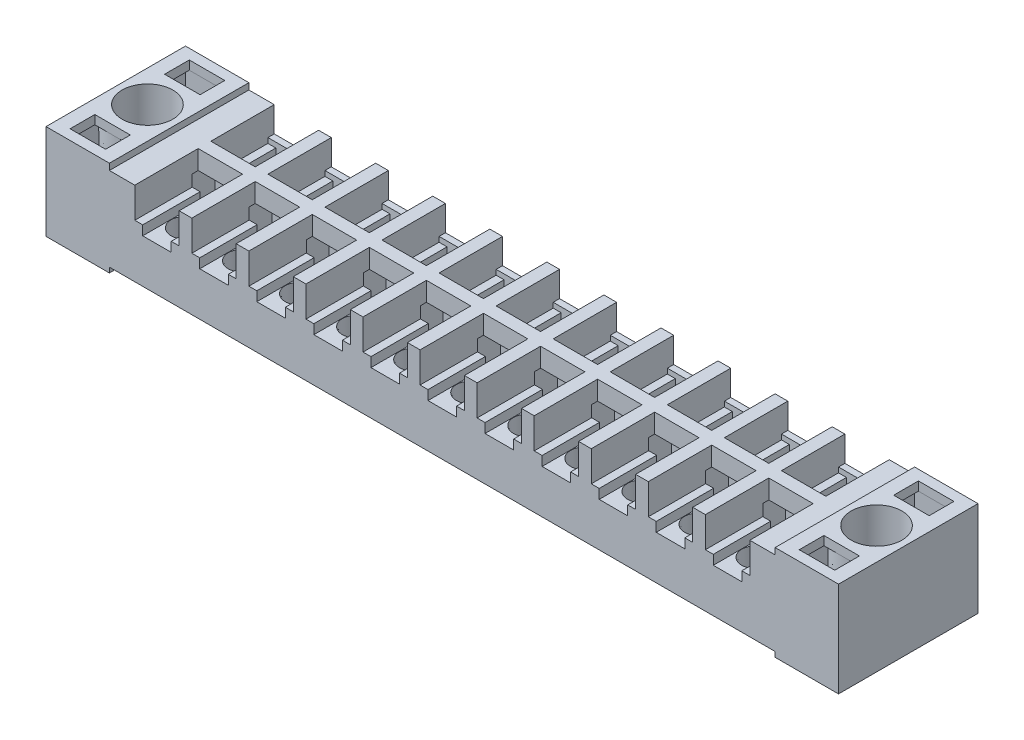
from build123d import *

# Parameters (mm, degrees)
SKETCH1_W                        = 125
SKETCH1_H                        = 22
MAIN_BODY_DEPTH                  = 15
CBORE_FOR_M4_SHCS1_D             = 4.8
CBORE_FOR_M4_SHCS1_CBORE_D       = 8
CBORE_FOR_M4_SHCS1_CBORE_DEPTH   = 11
SKETCH4_W                        = 5.6
SKETCH4_H                        = 3.9
TOP_RECTANGULAR_CUT_DEPTH        = 1.4
BOTTOM_RECTANGULAR_CUT_DEPTH     = 13.6
BOTTOM_RECTANGULAR_CUT_DRAFT     = -1
MIRROR6_COPY_1_DEPTH             = 13.6
MIRROR6_COPY_1_DRAFT             = -1
MIRROR8_COPY_1_DEPTH             = 13.6
MIRROR8_COPY_1_DRAFT             = -1
MIRROR8_COPY_2_SKETCH_W          = 5.6
MIRROR8_COPY_2_SKETCH_H          = 3.9
MIRROR8_COPY_2_DEPTH             = 1.4
MIRROR8_COPY_3_DEPTH             = 13.6
MIRROR8_COPY_3_DRAFT             = -1
SKETCH11_W                       = 105
SKETCH11_H                       = 22
BOTTOM_BASE_CUT_DEPTH            = 0.8
SKETCH6_W                        = 105
SKETCH6_H                        = 7
BOTTOM_BOSSED_FEATURE_BASE_DEPTH = 5.6
BOTTOM_BOSSED_FEATURE_BASE_DRAFT = -1
MIRROR9_COPY_1_SKETCH_W          = 105
MIRROR9_COPY_1_SKETCH_H          = 7
MIRROR9_COPY_1_DEPTH             = 5.6
MIRROR9_COPY_1_DRAFT             = -1
SKETCH7_R                        = 2.75
BOSSED_CYLINDER_DEPTH            = 5.6
BOSSED_CYLINDER_TAPER            = 1
FILL_PATTERN1_OUTLINE_R          = 2.652251636
FILL_PATTERN1_DEPTH              = 5.6
FILL_PATTERN1_DRAFT              = -1
FILL_PATTERN1_2_OUTLINE_R        = 2.652251636
FILL_PATTERN1_2_DEPTH            = 5.6
FILL_PATTERN1_2_DRAFT            = -1
FILL_PATTERN1_3_OUTLINE_R        = 2.652251636
FILL_PATTERN1_3_DEPTH            = 5.6
FILL_PATTERN1_3_DRAFT            = -1
FILL_PATTERN1_4_OUTLINE_R        = 2.652251636
FILL_PATTERN1_4_DEPTH            = 5.6
FILL_PATTERN1_4_DRAFT            = -1
FILL_PATTERN1_5_OUTLINE_R        = 2.652251636
FILL_PATTERN1_5_DEPTH            = 5.6
FILL_PATTERN1_5_DRAFT            = -1
FILL_PATTERN1_6_OUTLINE_R        = 2.652251636
FILL_PATTERN1_6_DEPTH            = 5.6
FILL_PATTERN1_6_DRAFT            = -1
FILL_PATTERN1_7_OUTLINE_R        = 2.652251636
FILL_PATTERN1_7_DEPTH            = 5.6
FILL_PATTERN1_7_DRAFT            = -1
FILL_PATTERN1_8_OUTLINE_R        = 2.652251636
FILL_PATTERN1_8_DEPTH            = 5.6
FILL_PATTERN1_8_DRAFT            = -1
FILL_PATTERN1_9_OUTLINE_R        = 2.652251636
FILL_PATTERN1_9_DEPTH            = 5.6
FILL_PATTERN1_9_DRAFT            = -1
FILL_PATTERN1_10_OUTLINE_R       = 2.652251636
FILL_PATTERN1_10_DEPTH           = 5.6
FILL_PATTERN1_10_DRAFT           = -1
FILL_PATTERN3_DEPTH              = 5.6
FILL_PATTERN3_DRAFT              = -1
FILL_PATTERN3_2_DEPTH            = 5.6
FILL_PATTERN3_2_DRAFT            = -1
FILL_PATTERN3_3_DEPTH            = 5.6
FILL_PATTERN3_3_DRAFT            = -1
FILL_PATTERN3_4_DEPTH            = 5.6
FILL_PATTERN3_4_DRAFT            = -1
FILL_PATTERN3_5_DEPTH            = 5.6
FILL_PATTERN3_5_DRAFT            = -1
FILL_PATTERN3_6_DEPTH            = 5.6
FILL_PATTERN3_6_DRAFT            = -1
FILL_PATTERN3_7_DEPTH            = 5.6
FILL_PATTERN3_7_DRAFT            = -1
FILL_PATTERN3_8_DEPTH            = 5.6
FILL_PATTERN3_8_DRAFT            = -1
FILL_PATTERN3_9_DEPTH            = 5.6
FILL_PATTERN3_9_DRAFT            = -1
FILL_PATTERN3_10_DEPTH           = 5.6
FILL_PATTERN3_10_DRAFT           = -1
SKETCH12_W                       = 105
SKETCH12_H                       = 22
TOP_BASE_CUT_DEPTH               = 1
SKETCH8_W                        = 7
SKETCH8_H                        = 10
SMALL_DEPTH_TERMINAL_CUT_DEPTH   = 4
SKETCH9_W                        = 7
SKETCH9_H                        = 10
LARGE_DEPTH_TERMINAL_CUT_DEPTH   = 4.8
SKETCH10_W                       = 7.6
SKETCH10_H                       = 3.9
MID_RECTANGULAR_CUT_DEPTH        = 10.2
SKETCH13_W                       = 4.5
SKETCH13_H                       = 21
STRIP_CUT_DEPTH                  = 1.5
SKETCH14_W                       = 7
SKETCH14_H                       = 8.05
TERMINAL_CUT_REAR_DEPTH          = 0.8
LPATTERN2_COUNT                  = 6
LPATTERN2_PITCH                  = 9
LPATTERN2_COL_COUNT              = 6
LPATTERN2_COL_PITCH              = 9
LPATTERN3_COUNT                  = 6
LPATTERN3_PITCH                  = 9
LPATTERN3_COL_COUNT              = 6
LPATTERN3_COL_PITCH              = 9
SKETCH15_R                       = 2.2
BOSSED_CYLINDER_CUT_DEPTH        = 4
BOSSED_CYLINDER_CUT_DRAFT        = -1
MIRROR11_COPY_1_SKETCH_R         = 2.2
MIRROR11_COPY_1_DEPTH            = 4
MIRROR11_COPY_1_DRAFT            = -1
LPATTERN4_COPY_1_SKETCH_R        = 2.2
LPATTERN4_COPY_1_DEPTH           = 4
LPATTERN4_COPY_1_DRAFT           = -1
LPATTERN4_COPY_2_SKETCH_R        = 2.2
LPATTERN4_COPY_2_DEPTH           = 4
LPATTERN4_COPY_2_DRAFT           = -1
LPATTERN4_COPY_3_SKETCH_R        = 2.2
LPATTERN4_COPY_3_DEPTH           = 4
LPATTERN4_COPY_3_DRAFT           = -1
LPATTERN4_COPY_4_SKETCH_R        = 2.2
LPATTERN4_COPY_4_DEPTH           = 4
LPATTERN4_COPY_4_DRAFT           = -1
LPATTERN4_COPY_5_SKETCH_R        = 2.2
LPATTERN4_COPY_5_DEPTH           = 4
LPATTERN4_COPY_5_DRAFT           = -1
LPATTERN4_COPY_6_SKETCH_R        = 2.2
LPATTERN4_COPY_6_DEPTH           = 4
LPATTERN4_COPY_6_DRAFT           = -1
LPATTERN4_COPY_7_SKETCH_R        = 2.2
LPATTERN4_COPY_7_DEPTH           = 4
LPATTERN4_COPY_7_DRAFT           = -1
LPATTERN4_COPY_8_SKETCH_R        = 2.2
LPATTERN4_COPY_8_DEPTH           = 4
LPATTERN4_COPY_8_DRAFT           = -1
LPATTERN4_COPY_9_SKETCH_R        = 2.2
LPATTERN4_COPY_9_DEPTH           = 4
LPATTERN4_COPY_9_DRAFT           = -1
LPATTERN4_COPY_10_SKETCH_R       = 2.2
LPATTERN4_COPY_10_DEPTH          = 4
LPATTERN4_COPY_10_DRAFT          = -1
LPATTERN4_COL_COPY_1_SKETCH_R    = 2.2
LPATTERN4_COL_COPY_1_DEPTH       = 4
LPATTERN4_COL_COPY_1_DRAFT       = -1
LPATTERN4_COL_COPY_2_SKETCH_R    = 2.2
LPATTERN4_COL_COPY_2_DEPTH       = 4
LPATTERN4_COL_COPY_2_DRAFT       = -1
LPATTERN4_COL_COPY_3_SKETCH_R    = 2.2
LPATTERN4_COL_COPY_3_DEPTH       = 4
LPATTERN4_COL_COPY_3_DRAFT       = -1
LPATTERN4_COL_COPY_4_SKETCH_R    = 2.2
LPATTERN4_COL_COPY_4_DEPTH       = 4
LPATTERN4_COL_COPY_4_DRAFT       = -1
LPATTERN4_COL_COPY_5_SKETCH_R    = 2.2
LPATTERN4_COL_COPY_5_DEPTH       = 4
LPATTERN4_COL_COPY_5_DRAFT       = -1
LPATTERN4_COL_COPY_6_SKETCH_R    = 2.2
LPATTERN4_COL_COPY_6_DEPTH       = 4
LPATTERN4_COL_COPY_6_DRAFT       = -1
LPATTERN4_COL_COPY_7_SKETCH_R    = 2.2
LPATTERN4_COL_COPY_7_DEPTH       = 4
LPATTERN4_COL_COPY_7_DRAFT       = -1
LPATTERN4_COL_COPY_8_SKETCH_R    = 2.2
LPATTERN4_COL_COPY_8_DEPTH       = 4
LPATTERN4_COL_COPY_8_DRAFT       = -1
LPATTERN4_COL_COPY_9_SKETCH_R    = 2.2
LPATTERN4_COL_COPY_9_DEPTH       = 4
LPATTERN4_COL_COPY_9_DRAFT       = -1
LPATTERN4_COL_COPY_10_SKETCH_R   = 2.2
LPATTERN4_COL_COPY_10_DEPTH      = 4
LPATTERN4_COL_COPY_10_DRAFT      = -1


# Read off the part's stored shape, not the designer's step: Fill Pattern1, Fill Pattern3
with BuildPart() as part:
    # Sketch1 → MAIN BODY (new body)
    with BuildSketch(Plane(origin=(0, 0, 0), x_dir=(1, 0, 0), z_dir=(0, 1, 0))):
        Rectangle(SKETCH1_W, SKETCH1_H)
    extrude(amount=MAIN_BODY_DEPTH)

    # CBORE for M4 SHCS1 (through all)
    with Locations(Plane(origin=(0, 15, 0), x_dir=(1, 0, 0), z_dir=(0, 1, 0))):
        with Locations((-57.5, 0)):
            cbore_for_m4_shcs1 = CounterBoreHole(CBORE_FOR_M4_SHCS1_D / 2, CBORE_FOR_M4_SHCS1_CBORE_D / 2, CBORE_FOR_M4_SHCS1_CBORE_DEPTH)

    # Sketch4 → TOP RECTANGULAR CUT (cut)
    with BuildSketch(Plane(origin=(0, 15, 0), x_dir=(1, 0, 0), z_dir=(0, 1, 0))):
        with Locations((-57.5, 7.45)):
            Rectangle(SKETCH4_W, SKETCH4_H)
    top_rectangular_cut = extrude(amount=-TOP_RECTANGULAR_CUT_DEPTH, mode=Mode.SUBTRACT)


with BuildPart() as bottom_rectangular_cut_tool:
    # Sketch5 → BOTTOM RECTANGULAR CUT (with draft: the straight prism first)
    with BuildSketch(Plane.XZ):
        with BuildLine():
            Line((-53.8, -9.7), (-53.8, -3.724580513))
            ThreePointArc((-53.8, -3.724580513), (-57.5, -5.25), (-61.2, -3.724580513))
            Line((-61.2, -3.724580513), (-61.2, -9.7))
            Line((-61.2, -9.7), (-53.8, -9.7))
        make_face()
    extrude(amount=-BOTTOM_RECTANGULAR_CUT_DEPTH)
    # BOTTOM RECTANGULAR CUT: the draft: its side faces are tilted about the plane it starts from
    bottom_rectangular_cut_sides = [bottom_rectangular_cut_tool.faces().sort_by_distance(p)[0] for p in [
        (-57.5, 6.8, -5.25),
        (-61.2, 6.8, -6.712290257),
        (-57.5, 6.8, -9.7),
        (-53.8, 6.8, -6.712290257),
    ]]
    draft(bottom_rectangular_cut_sides, Plane.XZ, BOTTOM_RECTANGULAR_CUT_DRAFT)


with BuildPart() as part_1:
    add(part.part)

    # BOTTOM RECTANGULAR CUT: cut by bottom_rectangular_cut_tool
    add(bottom_rectangular_cut_tool.part, mode=Mode.SUBTRACT)

    # Mirror1: CBORE for M4 SHCS1 across plane
    add(cbore_for_m4_shcs1.mirror(Plane(origin=(0, 0, 0), x_dir=(0, 0, 1), z_dir=(1, 0, 0))), mode=Mode.SUBTRACT)

    # Mirror6: TOP RECTANGULAR CUT across plane
    add(top_rectangular_cut.mirror(Plane.XY), mode=Mode.SUBTRACT)


with BuildPart() as mirror6_copy_1_tool:
    # Mirror6 copy 1 sketch → Mirror6 copy 1 (with draft: the straight prism first)
    with BuildSketch(Plane.XZ):
        with BuildLine():
            Line((-53.8, 9.7), (-53.8, 3.724580513))
            ThreePointArc((-53.8, 3.724580513), (-57.5, 5.25), (-61.2, 3.724580513))
            Line((-61.2, 3.724580513), (-61.2, 9.7))
            Line((-61.2, 9.7), (-53.8, 9.7))
        make_face()
    extrude(amount=-MIRROR6_COPY_1_DEPTH)
    # Mirror6 copy 1: the draft: its side faces are tilted about the plane it starts from
    mirror6_copy_1_sides = [mirror6_copy_1_tool.faces().sort_by_distance(p)[0] for p in [
        (-57.5, 6.8, 5.25),
        (-61.2, 6.8, 6.712290257),
        (-57.5, 6.8, 9.7),
        (-53.8, 6.8, 6.712290257),
    ]]
    draft(mirror6_copy_1_sides, Plane.XZ, MIRROR6_COPY_1_DRAFT)


with BuildPart() as part_2:
    add(part_1.part)

    # Mirror6 copy 1: cut by mirror6_copy_1_tool
    add(mirror6_copy_1_tool.part, mode=Mode.SUBTRACT)

    # Mirror8: TOP RECTANGULAR CUT across plane
    add(top_rectangular_cut.mirror(Plane(origin=(0, 0, 0), x_dir=(0, 0, 1), z_dir=(1, 0, 0))), mode=Mode.SUBTRACT)


with BuildPart() as mirror8_copy_1_tool:
    # Mirror8 copy 1 sketch → Mirror8 copy 1 (with draft: the straight prism first)
    with BuildSketch(Plane(origin=(0, 0, 0), x_dir=(-1, 0, 0), z_dir=(0, -1, 0))):
        with BuildLine():
            Line((-53.8, 9.7), (-53.8, 3.724580513))
            ThreePointArc((-53.8, 3.724580513), (-57.5, 5.25), (-61.2, 3.724580513))
            Line((-61.2, 3.724580513), (-61.2, 9.7))
            Line((-61.2, 9.7), (-53.8, 9.7))
        make_face()
    extrude(amount=-MIRROR8_COPY_1_DEPTH)
    # Mirror8 copy 1: the draft: its side faces are tilted about the plane it starts from
    mirror8_copy_1_sides = [mirror8_copy_1_tool.faces().sort_by_distance(p)[0] for p in [
        (57.5, 6.8, -5.25),
        (61.2, 6.8, -6.712290257),
        (57.5, 6.8, -9.7),
        (53.8, 6.8, -6.712290257),
    ]]
    draft(mirror8_copy_1_sides, Plane(origin=(0, 0, 0), x_dir=(-1, 0, 0), z_dir=(0, -1, 0)), MIRROR8_COPY_1_DRAFT)


with BuildPart() as part_3:
    add(part_2.part)

    # Mirror8 copy 1: cut by mirror8_copy_1_tool
    add(mirror8_copy_1_tool.part, mode=Mode.SUBTRACT)

    # Mirror8 copy 2 sketch → Mirror8 copy 2 (cut)
    with BuildSketch(Plane(origin=(0, 15, 0), x_dir=(-1, 0, 0), z_dir=(0, 1, 0))):
        with Locations((-57.5, 7.45)):
            Rectangle(MIRROR8_COPY_2_SKETCH_W, MIRROR8_COPY_2_SKETCH_H)
    extrude(amount=-MIRROR8_COPY_2_DEPTH, mode=Mode.SUBTRACT)


with BuildPart() as mirror8_copy_3_tool:
    # Mirror8 copy 3 sketch → Mirror8 copy 3 (with draft: the straight prism first)
    with BuildSketch(Plane(origin=(0, 0, 0), x_dir=(-1, 0, 0), z_dir=(0, -1, 0))):
        with BuildLine():
            Line((-53.8, -9.7), (-53.8, -3.724580513))
            ThreePointArc((-53.8, -3.724580513), (-57.5, -5.25), (-61.2, -3.724580513))
            Line((-61.2, -3.724580513), (-61.2, -9.7))
            Line((-61.2, -9.7), (-53.8, -9.7))
        make_face()
    extrude(amount=-MIRROR8_COPY_3_DEPTH)
    # Mirror8 copy 3: the draft: its side faces are tilted about the plane it starts from
    mirror8_copy_3_sides = [mirror8_copy_3_tool.faces().sort_by_distance(p)[0] for p in [
        (57.5, 6.8, 5.25),
        (61.2, 6.8, 6.712290257),
        (57.5, 6.8, 9.7),
        (53.8, 6.8, 6.712290257),
    ]]
    draft(mirror8_copy_3_sides, Plane(origin=(0, 0, 0), x_dir=(-1, 0, 0), z_dir=(0, -1, 0)), MIRROR8_COPY_3_DRAFT)


with BuildPart() as part_4:
    add(part_3.part)

    # Mirror8 copy 3: cut by mirror8_copy_3_tool
    add(mirror8_copy_3_tool.part, mode=Mode.SUBTRACT)

    # Sketch11 → BOTTOM BASE CUT (cut)
    with BuildSketch(Plane(origin=(0, 0, 0), x_dir=(-1, 0, 0), z_dir=(0, -1, 0))):
        Rectangle(SKETCH11_W, SKETCH11_H)
    extrude(amount=-BOTTOM_BASE_CUT_DEPTH, mode=Mode.SUBTRACT)


with BuildPart() as bottom_bossed_feature_base_tool:
    # Sketch6 → BOTTOM BOSSED FEATURE BASE (with draft: the straight prism first)
    with BuildSketch(Plane(origin=(0, 0.8, 0), x_dir=(-1, 0, 0), z_dir=(0, -1, 0))):
        with Locations((0, 6.5)):
            Rectangle(SKETCH6_W, SKETCH6_H)
    extrude(amount=-BOTTOM_BOSSED_FEATURE_BASE_DEPTH)
    # BOTTOM BOSSED FEATURE BASE: the draft: its side faces are tilted about the plane it starts from
    bottom_bossed_feature_base_sides = [bottom_bossed_feature_base_tool.faces().sort_by_distance(p)[0] for p in [
        (0, 3.6, -10),
        (52.5, 3.6, -6.5),
        (0, 3.6, -3),
        (-52.5, 3.6, -6.5),
    ]]
    draft(bottom_bossed_feature_base_sides, Plane(origin=(0, 0.8, 0), x_dir=(-1, 0, 0), z_dir=(0, -1, 0)), BOTTOM_BOSSED_FEATURE_BASE_DRAFT)


with BuildPart() as part_5:
    add(part_4.part)

    # BOTTOM BOSSED FEATURE BASE: cut by bottom_bossed_feature_base_tool
    add(bottom_bossed_feature_base_tool.part, mode=Mode.SUBTRACT)


with BuildPart() as mirror9_copy_1_tool:
    # Mirror9 copy 1 sketch → Mirror9 copy 1 (with draft: the straight prism first)
    with BuildSketch(Plane(origin=(0, 0.8, 0), x_dir=(-1, 0, 0), z_dir=(0, -1, 0))):
        with Locations((0, -6.5)):
            Rectangle(MIRROR9_COPY_1_SKETCH_W, MIRROR9_COPY_1_SKETCH_H)
    extrude(amount=-MIRROR9_COPY_1_DEPTH)
    # Mirror9 copy 1: the draft: its side faces are tilted about the plane it starts from
    mirror9_copy_1_sides = [mirror9_copy_1_tool.faces().sort_by_distance(p)[0] for p in [
        (0, 3.6, 10),
        (52.5, 3.6, 6.5),
        (0, 3.6, 3),
        (-52.5, 3.6, 6.5),
    ]]
    draft(mirror9_copy_1_sides, Plane(origin=(0, 0.8, 0), x_dir=(-1, 0, 0), z_dir=(0, -1, 0)), MIRROR9_COPY_1_DRAFT)


with BuildPart() as part_6:
    add(part_5.part)

    # Mirror9 copy 1: cut by mirror9_copy_1_tool
    add(mirror9_copy_1_tool.part, mode=Mode.SUBTRACT)

    # Sketch7 → BOSSED CYLINDER (add)
    with BuildSketch(Plane(origin=(0, 6.4, 0), x_dir=(-1, 0, 0), z_dir=(0, -1, 0))):
        with Locations((0, 6.555856208)):
            Circle(SKETCH7_R)
    bossed_cylinder = extrude(amount=BOSSED_CYLINDER_DEPTH, taper=BOSSED_CYLINDER_TAPER)


with BuildPart() as fill_pattern1_tool:
    # Fill Pattern1 outline → Fill Pattern1 (with draft: the straight prism first)
    with BuildSketch(Plane(origin=(0, 0.8, 0), x_dir=(1, 0, 0), z_dir=(0, 1, 0))):
        with Locations((9, 6.555856208)):
            Circle(FILL_PATTERN1_OUTLINE_R)
    extrude(amount=FILL_PATTERN1_DEPTH)
    # Fill Pattern1: the draft: its side faces are tilted about the plane it starts from
    fill_pattern1_sides = [fill_pattern1_tool.faces().sort_by_distance(p)[0] for p in [
        (6.347748364, 3.6, -6.555856208),
    ]]
    draft(fill_pattern1_sides, Plane(origin=(0, 0.8, 0), x_dir=(1, 0, 0), z_dir=(0, 1, 0)), FILL_PATTERN1_DRAFT)


with BuildPart() as part_7:
    add(part_6.part)

    # Fill Pattern1: add fill_pattern1_tool
    add(fill_pattern1_tool.part)


with BuildPart() as fill_pattern1_2_tool:
    # Fill Pattern1 2 outline → Fill Pattern1 2 (with draft: the straight prism first)
    with BuildSketch(Plane(origin=(0, 0.8, 0), x_dir=(1, 0, 0), z_dir=(0, 1, 0))):
        with Locations((-9, 6.555856208)):
            Circle(FILL_PATTERN1_2_OUTLINE_R)
    extrude(amount=FILL_PATTERN1_2_DEPTH)
    # Fill Pattern1 2: the draft: its side faces are tilted about the plane it starts from
    fill_pattern1_2_sides = [fill_pattern1_2_tool.faces().sort_by_distance(p)[0] for p in [
        (-11.652251636, 3.6, -6.555856208),
    ]]
    draft(fill_pattern1_2_sides, Plane(origin=(0, 0.8, 0), x_dir=(1, 0, 0), z_dir=(0, 1, 0)), FILL_PATTERN1_2_DRAFT)


with BuildPart() as part_8:
    add(part_7.part)

    # Fill Pattern1 2: add fill_pattern1_2_tool
    add(fill_pattern1_2_tool.part)


with BuildPart() as fill_pattern1_3_tool:
    # Fill Pattern1 3 outline → Fill Pattern1 3 (with draft: the straight prism first)
    with BuildSketch(Plane(origin=(0, 0.8, 0), x_dir=(1, 0, 0), z_dir=(0, 1, 0))):
        with Locations((18, 6.555856208)):
            Circle(FILL_PATTERN1_3_OUTLINE_R)
    extrude(amount=FILL_PATTERN1_3_DEPTH)
    # Fill Pattern1 3: the draft: its side faces are tilted about the plane it starts from
    fill_pattern1_3_sides = [fill_pattern1_3_tool.faces().sort_by_distance(p)[0] for p in [
        (15.347748364, 3.6, -6.555856208),
    ]]
    draft(fill_pattern1_3_sides, Plane(origin=(0, 0.8, 0), x_dir=(1, 0, 0), z_dir=(0, 1, 0)), FILL_PATTERN1_3_DRAFT)


with BuildPart() as part_9:
    add(part_8.part)

    # Fill Pattern1 3: add fill_pattern1_3_tool
    add(fill_pattern1_3_tool.part)


with BuildPart() as fill_pattern1_4_tool:
    # Fill Pattern1 4 outline → Fill Pattern1 4 (with draft: the straight prism first)
    with BuildSketch(Plane(origin=(0, 0.8, 0), x_dir=(1, 0, 0), z_dir=(0, 1, 0))):
        with Locations((-18, 6.555856208)):
            Circle(FILL_PATTERN1_4_OUTLINE_R)
    extrude(amount=FILL_PATTERN1_4_DEPTH)
    # Fill Pattern1 4: the draft: its side faces are tilted about the plane it starts from
    fill_pattern1_4_sides = [fill_pattern1_4_tool.faces().sort_by_distance(p)[0] for p in [
        (-20.652251636, 3.6, -6.555856208),
    ]]
    draft(fill_pattern1_4_sides, Plane(origin=(0, 0.8, 0), x_dir=(1, 0, 0), z_dir=(0, 1, 0)), FILL_PATTERN1_4_DRAFT)


with BuildPart() as part_10:
    add(part_9.part)

    # Fill Pattern1 4: add fill_pattern1_4_tool
    add(fill_pattern1_4_tool.part)


with BuildPart() as fill_pattern1_5_tool:
    # Fill Pattern1 5 outline → Fill Pattern1 5 (with draft: the straight prism first)
    with BuildSketch(Plane(origin=(0, 0.8, 0), x_dir=(1, 0, 0), z_dir=(0, 1, 0))):
        with Locations((27, 6.555856208)):
            Circle(FILL_PATTERN1_5_OUTLINE_R)
    extrude(amount=FILL_PATTERN1_5_DEPTH)
    # Fill Pattern1 5: the draft: its side faces are tilted about the plane it starts from
    fill_pattern1_5_sides = [fill_pattern1_5_tool.faces().sort_by_distance(p)[0] for p in [
        (24.347748364, 3.6, -6.555856208),
    ]]
    draft(fill_pattern1_5_sides, Plane(origin=(0, 0.8, 0), x_dir=(1, 0, 0), z_dir=(0, 1, 0)), FILL_PATTERN1_5_DRAFT)


with BuildPart() as part_11:
    add(part_10.part)

    # Fill Pattern1 5: add fill_pattern1_5_tool
    add(fill_pattern1_5_tool.part)


with BuildPart() as fill_pattern1_6_tool:
    # Fill Pattern1 6 outline → Fill Pattern1 6 (with draft: the straight prism first)
    with BuildSketch(Plane(origin=(0, 0.8, 0), x_dir=(1, 0, 0), z_dir=(0, 1, 0))):
        with Locations((-27, 6.555856208)):
            Circle(FILL_PATTERN1_6_OUTLINE_R)
    extrude(amount=FILL_PATTERN1_6_DEPTH)
    # Fill Pattern1 6: the draft: its side faces are tilted about the plane it starts from
    fill_pattern1_6_sides = [fill_pattern1_6_tool.faces().sort_by_distance(p)[0] for p in [
        (-29.652251636, 3.6, -6.555856208),
    ]]
    draft(fill_pattern1_6_sides, Plane(origin=(0, 0.8, 0), x_dir=(1, 0, 0), z_dir=(0, 1, 0)), FILL_PATTERN1_6_DRAFT)


with BuildPart() as part_12:
    add(part_11.part)

    # Fill Pattern1 6: add fill_pattern1_6_tool
    add(fill_pattern1_6_tool.part)


with BuildPart() as fill_pattern1_7_tool:
    # Fill Pattern1 7 outline → Fill Pattern1 7 (with draft: the straight prism first)
    with BuildSketch(Plane(origin=(0, 0.8, 0), x_dir=(1, 0, 0), z_dir=(0, 1, 0))):
        with Locations((36, 6.555856208)):
            Circle(FILL_PATTERN1_7_OUTLINE_R)
    extrude(amount=FILL_PATTERN1_7_DEPTH)
    # Fill Pattern1 7: the draft: its side faces are tilted about the plane it starts from
    fill_pattern1_7_sides = [fill_pattern1_7_tool.faces().sort_by_distance(p)[0] for p in [
        (33.347748364, 3.6, -6.555856208),
    ]]
    draft(fill_pattern1_7_sides, Plane(origin=(0, 0.8, 0), x_dir=(1, 0, 0), z_dir=(0, 1, 0)), FILL_PATTERN1_7_DRAFT)


with BuildPart() as part_13:
    add(part_12.part)

    # Fill Pattern1 7: add fill_pattern1_7_tool
    add(fill_pattern1_7_tool.part)


with BuildPart() as fill_pattern1_8_tool:
    # Fill Pattern1 8 outline → Fill Pattern1 8 (with draft: the straight prism first)
    with BuildSketch(Plane(origin=(0, 0.8, 0), x_dir=(1, 0, 0), z_dir=(0, 1, 0))):
        with Locations((-36, 6.555856208)):
            Circle(FILL_PATTERN1_8_OUTLINE_R)
    extrude(amount=FILL_PATTERN1_8_DEPTH)
    # Fill Pattern1 8: the draft: its side faces are tilted about the plane it starts from
    fill_pattern1_8_sides = [fill_pattern1_8_tool.faces().sort_by_distance(p)[0] for p in [
        (-38.652251636, 3.6, -6.555856208),
    ]]
    draft(fill_pattern1_8_sides, Plane(origin=(0, 0.8, 0), x_dir=(1, 0, 0), z_dir=(0, 1, 0)), FILL_PATTERN1_8_DRAFT)


with BuildPart() as part_14:
    add(part_13.part)

    # Fill Pattern1 8: add fill_pattern1_8_tool
    add(fill_pattern1_8_tool.part)


with BuildPart() as fill_pattern1_9_tool:
    # Fill Pattern1 9 outline → Fill Pattern1 9 (with draft: the straight prism first)
    with BuildSketch(Plane(origin=(0, 0.8, 0), x_dir=(1, 0, 0), z_dir=(0, 1, 0))):
        with Locations((45, 6.555856208)):
            Circle(FILL_PATTERN1_9_OUTLINE_R)
    extrude(amount=FILL_PATTERN1_9_DEPTH)
    # Fill Pattern1 9: the draft: its side faces are tilted about the plane it starts from
    fill_pattern1_9_sides = [fill_pattern1_9_tool.faces().sort_by_distance(p)[0] for p in [
        (42.347748364, 3.6, -6.555856208),
    ]]
    draft(fill_pattern1_9_sides, Plane(origin=(0, 0.8, 0), x_dir=(1, 0, 0), z_dir=(0, 1, 0)), FILL_PATTERN1_9_DRAFT)


with BuildPart() as part_15:
    add(part_14.part)

    # Fill Pattern1 9: add fill_pattern1_9_tool
    add(fill_pattern1_9_tool.part)


with BuildPart() as fill_pattern1_10_tool:
    # Fill Pattern1 10 outline → Fill Pattern1 10 (with draft: the straight prism first)
    with BuildSketch(Plane(origin=(0, 0.8, 0), x_dir=(1, 0, 0), z_dir=(0, 1, 0))):
        with Locations((-45, 6.555856208)):
            Circle(FILL_PATTERN1_10_OUTLINE_R)
    extrude(amount=FILL_PATTERN1_10_DEPTH)
    # Fill Pattern1 10: the draft: its side faces are tilted about the plane it starts from
    fill_pattern1_10_sides = [fill_pattern1_10_tool.faces().sort_by_distance(p)[0] for p in [
        (-47.652251636, 3.6, -6.555856208),
    ]]
    draft(fill_pattern1_10_sides, Plane(origin=(0, 0.8, 0), x_dir=(1, 0, 0), z_dir=(0, 1, 0)), FILL_PATTERN1_10_DRAFT)


with BuildPart() as part_16:
    add(part_15.part)

    # Fill Pattern1 10: add fill_pattern1_10_tool
    add(fill_pattern1_10_tool.part)

    # Mirror10: BOSSED CYLINDER across plane
    add(bossed_cylinder.mirror(Plane.XY))


with BuildPart() as fill_pattern3_tool:
    # Fill Pattern3 outline → Fill Pattern3 (with draft: the straight prism first)
    with BuildSketch(Plane(origin=(0, 0.8, 0), x_dir=(1, 0, 0), z_dir=(0, 1, 0))):
        with BuildLine():
            ThreePointArc((9, -3.903604571), (6.347748364, -6.555856208), (9, -9.208107844))
            ThreePointArc((9, -9.208107844), (11.652251636, -6.555856208), (9, -3.903604571))
        make_face()
    extrude(amount=FILL_PATTERN3_DEPTH)
    # Fill Pattern3: the draft: its side faces are tilted about the plane it starts from
    fill_pattern3_sides = [fill_pattern3_tool.faces().sort_by_distance(p)[0] for p in [
        (6.347748364, 3.6, 6.555856208),
        (11.652251636, 3.6, 6.555856207),
    ]]
    draft(fill_pattern3_sides, Plane(origin=(0, 0.8, 0), x_dir=(1, 0, 0), z_dir=(0, 1, 0)), FILL_PATTERN3_DRAFT)


with BuildPart() as part_17:
    add(part_16.part)

    # Fill Pattern3: add fill_pattern3_tool
    add(fill_pattern3_tool.part)


with BuildPart() as fill_pattern3_2_tool:
    # Fill Pattern3 2 outline → Fill Pattern3 2 (with draft: the straight prism first)
    with BuildSketch(Plane(origin=(0, 0.8, 0), x_dir=(1, 0, 0), z_dir=(0, 1, 0))):
        with BuildLine():
            ThreePointArc((18, -3.903604571), (15.347748364, -6.555856208), (18, -9.208107844))
            ThreePointArc((18, -9.208107844), (20.652251636, -6.555856208), (18, -3.903604571))
        make_face()
    extrude(amount=FILL_PATTERN3_2_DEPTH)
    # Fill Pattern3 2: the draft: its side faces are tilted about the plane it starts from
    fill_pattern3_2_sides = [fill_pattern3_2_tool.faces().sort_by_distance(p)[0] for p in [
        (20.652251636, 3.6, 6.555856207),
        (15.347748364, 3.6, 6.555856208),
    ]]
    draft(fill_pattern3_2_sides, Plane(origin=(0, 0.8, 0), x_dir=(1, 0, 0), z_dir=(0, 1, 0)), FILL_PATTERN3_2_DRAFT)


with BuildPart() as part_18:
    add(part_17.part)

    # Fill Pattern3 2: add fill_pattern3_2_tool
    add(fill_pattern3_2_tool.part)


with BuildPart() as fill_pattern3_3_tool:
    # Fill Pattern3 3 outline → Fill Pattern3 3 (with draft: the straight prism first)
    with BuildSketch(Plane(origin=(0, 0.8, 0), x_dir=(1, 0, 0), z_dir=(0, 1, 0))):
        with BuildLine():
            ThreePointArc((27, -3.903604571), (24.347748364, -6.555856208), (27, -9.208107844))
            ThreePointArc((27, -9.208107844), (29.652251636, -6.555856208), (27, -3.903604571))
        make_face()
    extrude(amount=FILL_PATTERN3_3_DEPTH)
    # Fill Pattern3 3: the draft: its side faces are tilted about the plane it starts from
    fill_pattern3_3_sides = [fill_pattern3_3_tool.faces().sort_by_distance(p)[0] for p in [
        (29.652251636, 3.6, 6.555856207),
        (24.347748364, 3.6, 6.555856208),
    ]]
    draft(fill_pattern3_3_sides, Plane(origin=(0, 0.8, 0), x_dir=(1, 0, 0), z_dir=(0, 1, 0)), FILL_PATTERN3_3_DRAFT)


with BuildPart() as part_19:
    add(part_18.part)

    # Fill Pattern3 3: add fill_pattern3_3_tool
    add(fill_pattern3_3_tool.part)


with BuildPart() as fill_pattern3_4_tool:
    # Fill Pattern3 4 outline → Fill Pattern3 4 (with draft: the straight prism first)
    with BuildSketch(Plane(origin=(0, 0.8, 0), x_dir=(1, 0, 0), z_dir=(0, 1, 0))):
        with BuildLine():
            ThreePointArc((36, -3.903604571), (33.347748364, -6.555856208), (36, -9.208107844))
            ThreePointArc((36, -9.208107844), (38.652251636, -6.555856208), (36, -3.903604571))
        make_face()
    extrude(amount=FILL_PATTERN3_4_DEPTH)
    # Fill Pattern3 4: the draft: its side faces are tilted about the plane it starts from
    fill_pattern3_4_sides = [fill_pattern3_4_tool.faces().sort_by_distance(p)[0] for p in [
        (33.347748364, 3.6, 6.555856208),
        (38.652251636, 3.6, 6.555856208),
    ]]
    draft(fill_pattern3_4_sides, Plane(origin=(0, 0.8, 0), x_dir=(1, 0, 0), z_dir=(0, 1, 0)), FILL_PATTERN3_4_DRAFT)


with BuildPart() as part_20:
    add(part_19.part)

    # Fill Pattern3 4: add fill_pattern3_4_tool
    add(fill_pattern3_4_tool.part)


with BuildPart() as fill_pattern3_5_tool:
    # Fill Pattern3 5 outline → Fill Pattern3 5 (with draft: the straight prism first)
    with BuildSketch(Plane(origin=(0, 0.8, 0), x_dir=(1, 0, 0), z_dir=(0, 1, 0))):
        with BuildLine():
            ThreePointArc((-9, -3.903604571), (-11.652251636, -6.555856208), (-9, -9.208107844))
            ThreePointArc((-9, -9.208107844), (-6.347748364, -6.555856208), (-9, -3.903604571))
        make_face()
    extrude(amount=FILL_PATTERN3_5_DEPTH)
    # Fill Pattern3 5: the draft: its side faces are tilted about the plane it starts from
    fill_pattern3_5_sides = [fill_pattern3_5_tool.faces().sort_by_distance(p)[0] for p in [
        (-11.652251636, 3.6, 6.555856208),
        (-6.347748364, 3.6, 6.555856208),
    ]]
    draft(fill_pattern3_5_sides, Plane(origin=(0, 0.8, 0), x_dir=(1, 0, 0), z_dir=(0, 1, 0)), FILL_PATTERN3_5_DRAFT)


with BuildPart() as part_21:
    add(part_20.part)

    # Fill Pattern3 5: add fill_pattern3_5_tool
    add(fill_pattern3_5_tool.part)


with BuildPart() as fill_pattern3_6_tool:
    # Fill Pattern3 6 outline → Fill Pattern3 6 (with draft: the straight prism first)
    with BuildSketch(Plane(origin=(0, 0.8, 0), x_dir=(1, 0, 0), z_dir=(0, 1, 0))):
        with BuildLine():
            ThreePointArc((45, -3.903604571), (42.347748364, -6.555856208), (45, -9.208107844))
            ThreePointArc((45, -9.208107844), (47.652251636, -6.555856208), (45, -3.903604571))
        make_face()
    extrude(amount=FILL_PATTERN3_6_DEPTH)
    # Fill Pattern3 6: the draft: its side faces are tilted about the plane it starts from
    fill_pattern3_6_sides = [fill_pattern3_6_tool.faces().sort_by_distance(p)[0] for p in [
        (42.347748364, 3.6, 6.555856208),
        (47.652251636, 3.6, 6.555856208),
    ]]
    draft(fill_pattern3_6_sides, Plane(origin=(0, 0.8, 0), x_dir=(1, 0, 0), z_dir=(0, 1, 0)), FILL_PATTERN3_6_DRAFT)


with BuildPart() as part_22:
    add(part_21.part)

    # Fill Pattern3 6: add fill_pattern3_6_tool
    add(fill_pattern3_6_tool.part)


with BuildPart() as fill_pattern3_7_tool:
    # Fill Pattern3 7 outline → Fill Pattern3 7 (with draft: the straight prism first)
    with BuildSketch(Plane(origin=(0, 0.8, 0), x_dir=(1, 0, 0), z_dir=(0, 1, 0))):
        with BuildLine():
            ThreePointArc((-18, -3.903604571), (-20.652251636, -6.555856208), (-18, -9.208107844))
            ThreePointArc((-18, -9.208107844), (-15.347748364, -6.555856208), (-18, -3.903604571))
        make_face()
    extrude(amount=FILL_PATTERN3_7_DEPTH)
    # Fill Pattern3 7: the draft: its side faces are tilted about the plane it starts from
    fill_pattern3_7_sides = [fill_pattern3_7_tool.faces().sort_by_distance(p)[0] for p in [
        (-20.652251636, 3.6, 6.555856208),
        (-15.347748364, 3.6, 6.555856207),
    ]]
    draft(fill_pattern3_7_sides, Plane(origin=(0, 0.8, 0), x_dir=(1, 0, 0), z_dir=(0, 1, 0)), FILL_PATTERN3_7_DRAFT)


with BuildPart() as part_23:
    add(part_22.part)

    # Fill Pattern3 7: add fill_pattern3_7_tool
    add(fill_pattern3_7_tool.part)


with BuildPart() as fill_pattern3_8_tool:
    # Fill Pattern3 8 outline → Fill Pattern3 8 (with draft: the straight prism first)
    with BuildSketch(Plane(origin=(0, 0.8, 0), x_dir=(1, 0, 0), z_dir=(0, 1, 0))):
        with BuildLine():
            ThreePointArc((-27, -3.903604571), (-29.652251636, -6.555856208), (-27, -9.208107844))
            ThreePointArc((-27, -9.208107844), (-24.347748364, -6.555856208), (-27, -3.903604571))
        make_face()
    extrude(amount=FILL_PATTERN3_8_DEPTH)
    # Fill Pattern3 8: the draft: its side faces are tilted about the plane it starts from
    fill_pattern3_8_sides = [fill_pattern3_8_tool.faces().sort_by_distance(p)[0] for p in [
        (-24.347748364, 3.6, 6.555856207),
        (-29.652251636, 3.6, 6.555856208),
    ]]
    draft(fill_pattern3_8_sides, Plane(origin=(0, 0.8, 0), x_dir=(1, 0, 0), z_dir=(0, 1, 0)), FILL_PATTERN3_8_DRAFT)


with BuildPart() as part_24:
    add(part_23.part)

    # Fill Pattern3 8: add fill_pattern3_8_tool
    add(fill_pattern3_8_tool.part)


with BuildPart() as fill_pattern3_9_tool:
    # Fill Pattern3 9 outline → Fill Pattern3 9 (with draft: the straight prism first)
    with BuildSketch(Plane(origin=(0, 0.8, 0), x_dir=(1, 0, 0), z_dir=(0, 1, 0))):
        with BuildLine():
            ThreePointArc((-36, -3.903604571), (-38.652251636, -6.555856208), (-36, -9.208107844))
            ThreePointArc((-36, -9.208107844), (-33.347748364, -6.555856208), (-36, -3.903604571))
        make_face()
    extrude(amount=FILL_PATTERN3_9_DEPTH)
    # Fill Pattern3 9: the draft: its side faces are tilted about the plane it starts from
    fill_pattern3_9_sides = [fill_pattern3_9_tool.faces().sort_by_distance(p)[0] for p in [
        (-38.652251636, 3.6, 6.555856208),
        (-33.347748364, 3.6, 6.555856208),
    ]]
    draft(fill_pattern3_9_sides, Plane(origin=(0, 0.8, 0), x_dir=(1, 0, 0), z_dir=(0, 1, 0)), FILL_PATTERN3_9_DRAFT)


with BuildPart() as part_25:
    add(part_24.part)

    # Fill Pattern3 9: add fill_pattern3_9_tool
    add(fill_pattern3_9_tool.part)


with BuildPart() as fill_pattern3_10_tool:
    # Fill Pattern3 10 outline → Fill Pattern3 10 (with draft: the straight prism first)
    with BuildSketch(Plane(origin=(0, 0.8, 0), x_dir=(1, 0, 0), z_dir=(0, 1, 0))):
        with BuildLine():
            ThreePointArc((-45, -3.903604571), (-47.652251636, -6.555856208), (-45, -9.208107844))
            ThreePointArc((-45, -9.208107844), (-42.347748364, -6.555856208), (-45, -3.903604571))
        make_face()
    extrude(amount=FILL_PATTERN3_10_DEPTH)
    # Fill Pattern3 10: the draft: its side faces are tilted about the plane it starts from
    fill_pattern3_10_sides = [fill_pattern3_10_tool.faces().sort_by_distance(p)[0] for p in [
        (-47.652251636, 3.6, 6.555856208),
        (-42.347748364, 3.6, 6.555856208),
    ]]
    draft(fill_pattern3_10_sides, Plane(origin=(0, 0.8, 0), x_dir=(1, 0, 0), z_dir=(0, 1, 0)), FILL_PATTERN3_10_DRAFT)


with BuildPart() as part_26:
    add(part_25.part)

    # Fill Pattern3 10: add fill_pattern3_10_tool
    add(fill_pattern3_10_tool.part)

    # Sketch12 → TOP BASE CUT (cut)
    with BuildSketch(Plane(origin=(0, 15, 0), x_dir=(1, 0, 0), z_dir=(0, 1, 0))):
        Rectangle(SKETCH12_W, SKETCH12_H)
    extrude(amount=-TOP_BASE_CUT_DEPTH, mode=Mode.SUBTRACT)

    # Sketch8 → SMALL DEPTH TERMINAL CUT (cut)
    with BuildSketch(Plane(origin=(0, 14, 0), x_dir=(1, 0, 0), z_dir=(0, 1, 0))):
        with Locations((0, 6)):
            Rectangle(SKETCH8_W, SKETCH8_H)
    small_depth_terminal_cut = extrude(amount=-SMALL_DEPTH_TERMINAL_CUT_DEPTH, mode=Mode.SUBTRACT)

    # Sketch9 → LARGE DEPTH TERMINAL CUT (cut)
    with BuildSketch(Plane(origin=(0, 14, 0), x_dir=(1, 0, 0), z_dir=(0, 1, 0))):
        with Locations((0, -6)):
            Rectangle(SKETCH9_W, SKETCH9_H)
    large_depth_terminal_cut = extrude(amount=-LARGE_DEPTH_TERMINAL_CUT_DEPTH, mode=Mode.SUBTRACT)

    # Sketch10 → MID RECTANGULAR CUT (cut)
    with BuildSketch(Plane.XZ.offset(-0.8)):
        Rectangle(SKETCH10_W, SKETCH10_H)
    mid_rectangular_cut = extrude(amount=-MID_RECTANGULAR_CUT_DEPTH, mode=Mode.SUBTRACT)

    # Sketch13 → STRIP CUT (cut)
    with BuildSketch(Plane(origin=(0, 9.2, 0), x_dir=(1, 0, 0), z_dir=(0, 1, 0))):
        with Locations((0, -0.5)):
            Rectangle(SKETCH13_W, SKETCH13_H)
    strip_cut = extrude(amount=-STRIP_CUT_DEPTH, mode=Mode.SUBTRACT)

    # Sketch14 → TERMINAL CUT REAR (cut)
    with BuildSketch(Plane(origin=(0, 10, 0), x_dir=(1, 0, 0), z_dir=(0, 1, 0))):
        with Locations((0, 5.975)):
            Rectangle(SKETCH14_W, SKETCH14_H)
    terminal_cut_rear = extrude(amount=-TERMINAL_CUT_REAR_DEPTH, mode=Mode.SUBTRACT)

    # LPattern2: SMALL DEPTH TERMINAL CUT, LARGE DEPTH TERMINAL CUT, STRIP CUT, TERMINAL CUT REAR ×6
    with Locations(*[(i * LPATTERN2_PITCH, 0, 0) for i in range(1, LPATTERN2_COUNT)]):
        add(small_depth_terminal_cut, mode=Mode.SUBTRACT)
        add(large_depth_terminal_cut, mode=Mode.SUBTRACT)
        add(strip_cut, mode=Mode.SUBTRACT)
        add(terminal_cut_rear, mode=Mode.SUBTRACT)

    # LPattern2 col: SMALL DEPTH TERMINAL CUT, LARGE DEPTH TERMINAL CUT, STRIP CUT, TERMINAL CUT REAR ×6
    with Locations(*[(-i * LPATTERN2_COL_PITCH, 0, 0) for i in range(1, LPATTERN2_COL_COUNT)]):
        add(small_depth_terminal_cut, mode=Mode.SUBTRACT)
        add(large_depth_terminal_cut, mode=Mode.SUBTRACT)
        add(strip_cut, mode=Mode.SUBTRACT)
        add(terminal_cut_rear, mode=Mode.SUBTRACT)

    # LPattern3: MID RECTANGULAR CUT ×6
    with Locations(*[(i * LPATTERN3_PITCH, 0, 0) for i in range(1, LPATTERN3_COUNT)]):
        add(mid_rectangular_cut, mode=Mode.SUBTRACT)

    # LPattern3 col: MID RECTANGULAR CUT ×6
    with Locations(*[(-i * LPATTERN3_COL_PITCH, 0, 0) for i in range(1, LPATTERN3_COL_COUNT)]):
        add(mid_rectangular_cut, mode=Mode.SUBTRACT)


with BuildPart() as bossed_cylinder_cut_tool:
    # Sketch15 → BOSSED CYLINDER CUT (with draft: the straight prism first)
    with BuildSketch(Plane(origin=(0, 7.7, 0), x_dir=(1, 0, 0), z_dir=(0, 1, 0))):
        with Locations((0, 6.555856208)):
            Circle(SKETCH15_R)
    extrude(amount=-BOSSED_CYLINDER_CUT_DEPTH)
    # BOSSED CYLINDER CUT: the draft: its side faces are tilted about the plane it starts from
    bossed_cylinder_cut_sides = [bossed_cylinder_cut_tool.faces().sort_by_distance(p)[0] for p in [
        (-2.2, 5.7, -6.555856208),
    ]]
    draft(bossed_cylinder_cut_sides, Plane(origin=(0, 7.7, 0), x_dir=(1, 0, 0), z_dir=(0, 1, 0)), BOSSED_CYLINDER_CUT_DRAFT)


with BuildPart() as part_27:
    add(part_26.part)

    # BOSSED CYLINDER CUT: cut by bossed_cylinder_cut_tool
    add(bossed_cylinder_cut_tool.part, mode=Mode.SUBTRACT)


with BuildPart() as mirror11_copy_1_tool:
    # Mirror11 copy 1 sketch → Mirror11 copy 1 (with draft: the straight prism first)
    with BuildSketch(Plane(origin=(0, 7.7, 0), x_dir=(1, 0, 0), z_dir=(0, 1, 0))):
        with Locations((0, -6.555856208)):
            Circle(MIRROR11_COPY_1_SKETCH_R)
    extrude(amount=-MIRROR11_COPY_1_DEPTH)
    # Mirror11 copy 1: the draft: its side faces are tilted about the plane it starts from
    mirror11_copy_1_sides = [mirror11_copy_1_tool.faces().sort_by_distance(p)[0] for p in [
        (-2.2, 5.7, 6.555856208),
    ]]
    draft(mirror11_copy_1_sides, Plane(origin=(0, 7.7, 0), x_dir=(1, 0, 0), z_dir=(0, 1, 0)), MIRROR11_COPY_1_DRAFT)


with BuildPart() as part_28:
    add(part_27.part)

    # Mirror11 copy 1: cut by mirror11_copy_1_tool
    add(mirror11_copy_1_tool.part, mode=Mode.SUBTRACT)


with BuildPart() as lpattern4_copy_1_tool:
    # LPattern4 copy 1 sketch → LPattern4 copy 1 (with draft: the straight prism first)
    with BuildSketch(Plane(origin=(9, 7.7, 0), x_dir=(1, 0, 0), z_dir=(0, 1, 0))):
        with Locations((0, 6.555856208)):
            Circle(LPATTERN4_COPY_1_SKETCH_R)
    extrude(amount=-LPATTERN4_COPY_1_DEPTH)
    # LPattern4 copy 1: the draft: its side faces are tilted about the plane it starts from
    lpattern4_copy_1_sides = [lpattern4_copy_1_tool.faces().sort_by_distance(p)[0] for p in [
        (6.8, 5.7, -6.555856208),
    ]]
    draft(lpattern4_copy_1_sides, Plane(origin=(9, 7.7, 0), x_dir=(1, 0, 0), z_dir=(0, 1, 0)), LPATTERN4_COPY_1_DRAFT)


with BuildPart() as part_29:
    add(part_28.part)

    # LPattern4 copy 1: cut by lpattern4_copy_1_tool
    add(lpattern4_copy_1_tool.part, mode=Mode.SUBTRACT)


with BuildPart() as lpattern4_copy_2_tool:
    # LPattern4 copy 2 sketch → LPattern4 copy 2 (with draft: the straight prism first)
    with BuildSketch(Plane(origin=(18, 7.7, 0), x_dir=(1, 0, 0), z_dir=(0, 1, 0))):
        with Locations((0, 6.555856208)):
            Circle(LPATTERN4_COPY_2_SKETCH_R)
    extrude(amount=-LPATTERN4_COPY_2_DEPTH)
    # LPattern4 copy 2: the draft: its side faces are tilted about the plane it starts from
    lpattern4_copy_2_sides = [lpattern4_copy_2_tool.faces().sort_by_distance(p)[0] for p in [
        (15.8, 5.7, -6.555856208),
    ]]
    draft(lpattern4_copy_2_sides, Plane(origin=(18, 7.7, 0), x_dir=(1, 0, 0), z_dir=(0, 1, 0)), LPATTERN4_COPY_2_DRAFT)


with BuildPart() as part_30:
    add(part_29.part)

    # LPattern4 copy 2: cut by lpattern4_copy_2_tool
    add(lpattern4_copy_2_tool.part, mode=Mode.SUBTRACT)


with BuildPart() as lpattern4_copy_3_tool:
    # LPattern4 copy 3 sketch → LPattern4 copy 3 (with draft: the straight prism first)
    with BuildSketch(Plane(origin=(27, 7.7, 0), x_dir=(1, 0, 0), z_dir=(0, 1, 0))):
        with Locations((0, 6.555856208)):
            Circle(LPATTERN4_COPY_3_SKETCH_R)
    extrude(amount=-LPATTERN4_COPY_3_DEPTH)
    # LPattern4 copy 3: the draft: its side faces are tilted about the plane it starts from
    lpattern4_copy_3_sides = [lpattern4_copy_3_tool.faces().sort_by_distance(p)[0] for p in [
        (24.8, 5.7, -6.555856208),
    ]]
    draft(lpattern4_copy_3_sides, Plane(origin=(27, 7.7, 0), x_dir=(1, 0, 0), z_dir=(0, 1, 0)), LPATTERN4_COPY_3_DRAFT)


with BuildPart() as part_31:
    add(part_30.part)

    # LPattern4 copy 3: cut by lpattern4_copy_3_tool
    add(lpattern4_copy_3_tool.part, mode=Mode.SUBTRACT)


with BuildPart() as lpattern4_copy_4_tool:
    # LPattern4 copy 4 sketch → LPattern4 copy 4 (with draft: the straight prism first)
    with BuildSketch(Plane(origin=(36, 7.7, 0), x_dir=(1, 0, 0), z_dir=(0, 1, 0))):
        with Locations((0, 6.555856208)):
            Circle(LPATTERN4_COPY_4_SKETCH_R)
    extrude(amount=-LPATTERN4_COPY_4_DEPTH)
    # LPattern4 copy 4: the draft: its side faces are tilted about the plane it starts from
    lpattern4_copy_4_sides = [lpattern4_copy_4_tool.faces().sort_by_distance(p)[0] for p in [
        (33.8, 5.7, -6.555856208),
    ]]
    draft(lpattern4_copy_4_sides, Plane(origin=(36, 7.7, 0), x_dir=(1, 0, 0), z_dir=(0, 1, 0)), LPATTERN4_COPY_4_DRAFT)


with BuildPart() as part_32:
    add(part_31.part)

    # LPattern4 copy 4: cut by lpattern4_copy_4_tool
    add(lpattern4_copy_4_tool.part, mode=Mode.SUBTRACT)


with BuildPart() as lpattern4_copy_5_tool:
    # LPattern4 copy 5 sketch → LPattern4 copy 5 (with draft: the straight prism first)
    with BuildSketch(Plane(origin=(45, 7.7, 0), x_dir=(1, 0, 0), z_dir=(0, 1, 0))):
        with Locations((0, 6.555856208)):
            Circle(LPATTERN4_COPY_5_SKETCH_R)
    extrude(amount=-LPATTERN4_COPY_5_DEPTH)
    # LPattern4 copy 5: the draft: its side faces are tilted about the plane it starts from
    lpattern4_copy_5_sides = [lpattern4_copy_5_tool.faces().sort_by_distance(p)[0] for p in [
        (42.8, 5.7, -6.555856208),
    ]]
    draft(lpattern4_copy_5_sides, Plane(origin=(45, 7.7, 0), x_dir=(1, 0, 0), z_dir=(0, 1, 0)), LPATTERN4_COPY_5_DRAFT)


with BuildPart() as part_33:
    add(part_32.part)

    # LPattern4 copy 5: cut by lpattern4_copy_5_tool
    add(lpattern4_copy_5_tool.part, mode=Mode.SUBTRACT)


with BuildPart() as lpattern4_copy_6_tool:
    # LPattern4 copy 6 sketch → LPattern4 copy 6 (with draft: the straight prism first)
    with BuildSketch(Plane(origin=(9, 7.7, 0), x_dir=(1, 0, 0), z_dir=(0, 1, 0))):
        with Locations((0, -6.555856208)):
            Circle(LPATTERN4_COPY_6_SKETCH_R)
    extrude(amount=-LPATTERN4_COPY_6_DEPTH)
    # LPattern4 copy 6: the draft: its side faces are tilted about the plane it starts from
    lpattern4_copy_6_sides = [lpattern4_copy_6_tool.faces().sort_by_distance(p)[0] for p in [
        (6.8, 5.7, 6.555856208),
    ]]
    draft(lpattern4_copy_6_sides, Plane(origin=(9, 7.7, 0), x_dir=(1, 0, 0), z_dir=(0, 1, 0)), LPATTERN4_COPY_6_DRAFT)


with BuildPart() as part_34:
    add(part_33.part)

    # LPattern4 copy 6: cut by lpattern4_copy_6_tool
    add(lpattern4_copy_6_tool.part, mode=Mode.SUBTRACT)


with BuildPart() as lpattern4_copy_7_tool:
    # LPattern4 copy 7 sketch → LPattern4 copy 7 (with draft: the straight prism first)
    with BuildSketch(Plane(origin=(18, 7.7, 0), x_dir=(1, 0, 0), z_dir=(0, 1, 0))):
        with Locations((0, -6.555856208)):
            Circle(LPATTERN4_COPY_7_SKETCH_R)
    extrude(amount=-LPATTERN4_COPY_7_DEPTH)
    # LPattern4 copy 7: the draft: its side faces are tilted about the plane it starts from
    lpattern4_copy_7_sides = [lpattern4_copy_7_tool.faces().sort_by_distance(p)[0] for p in [
        (15.8, 5.7, 6.555856208),
    ]]
    draft(lpattern4_copy_7_sides, Plane(origin=(18, 7.7, 0), x_dir=(1, 0, 0), z_dir=(0, 1, 0)), LPATTERN4_COPY_7_DRAFT)


with BuildPart() as part_35:
    add(part_34.part)

    # LPattern4 copy 7: cut by lpattern4_copy_7_tool
    add(lpattern4_copy_7_tool.part, mode=Mode.SUBTRACT)


with BuildPart() as lpattern4_copy_8_tool:
    # LPattern4 copy 8 sketch → LPattern4 copy 8 (with draft: the straight prism first)
    with BuildSketch(Plane(origin=(27, 7.7, 0), x_dir=(1, 0, 0), z_dir=(0, 1, 0))):
        with Locations((0, -6.555856208)):
            Circle(LPATTERN4_COPY_8_SKETCH_R)
    extrude(amount=-LPATTERN4_COPY_8_DEPTH)
    # LPattern4 copy 8: the draft: its side faces are tilted about the plane it starts from
    lpattern4_copy_8_sides = [lpattern4_copy_8_tool.faces().sort_by_distance(p)[0] for p in [
        (24.8, 5.7, 6.555856208),
    ]]
    draft(lpattern4_copy_8_sides, Plane(origin=(27, 7.7, 0), x_dir=(1, 0, 0), z_dir=(0, 1, 0)), LPATTERN4_COPY_8_DRAFT)


with BuildPart() as part_36:
    add(part_35.part)

    # LPattern4 copy 8: cut by lpattern4_copy_8_tool
    add(lpattern4_copy_8_tool.part, mode=Mode.SUBTRACT)


with BuildPart() as lpattern4_copy_9_tool:
    # LPattern4 copy 9 sketch → LPattern4 copy 9 (with draft: the straight prism first)
    with BuildSketch(Plane(origin=(36, 7.7, 0), x_dir=(1, 0, 0), z_dir=(0, 1, 0))):
        with Locations((0, -6.555856208)):
            Circle(LPATTERN4_COPY_9_SKETCH_R)
    extrude(amount=-LPATTERN4_COPY_9_DEPTH)
    # LPattern4 copy 9: the draft: its side faces are tilted about the plane it starts from
    lpattern4_copy_9_sides = [lpattern4_copy_9_tool.faces().sort_by_distance(p)[0] for p in [
        (33.8, 5.7, 6.555856208),
    ]]
    draft(lpattern4_copy_9_sides, Plane(origin=(36, 7.7, 0), x_dir=(1, 0, 0), z_dir=(0, 1, 0)), LPATTERN4_COPY_9_DRAFT)


with BuildPart() as part_37:
    add(part_36.part)

    # LPattern4 copy 9: cut by lpattern4_copy_9_tool
    add(lpattern4_copy_9_tool.part, mode=Mode.SUBTRACT)


with BuildPart() as lpattern4_copy_10_tool:
    # LPattern4 copy 10 sketch → LPattern4 copy 10 (with draft: the straight prism first)
    with BuildSketch(Plane(origin=(45, 7.7, 0), x_dir=(1, 0, 0), z_dir=(0, 1, 0))):
        with Locations((0, -6.555856208)):
            Circle(LPATTERN4_COPY_10_SKETCH_R)
    extrude(amount=-LPATTERN4_COPY_10_DEPTH)
    # LPattern4 copy 10: the draft: its side faces are tilted about the plane it starts from
    lpattern4_copy_10_sides = [lpattern4_copy_10_tool.faces().sort_by_distance(p)[0] for p in [
        (42.8, 5.7, 6.555856208),
    ]]
    draft(lpattern4_copy_10_sides, Plane(origin=(45, 7.7, 0), x_dir=(1, 0, 0), z_dir=(0, 1, 0)), LPATTERN4_COPY_10_DRAFT)


with BuildPart() as part_38:
    add(part_37.part)

    # LPattern4 copy 10: cut by lpattern4_copy_10_tool
    add(lpattern4_copy_10_tool.part, mode=Mode.SUBTRACT)


with BuildPart() as lpattern4_col_copy_1_tool:
    # LPattern4 col copy 1 sketch → LPattern4 col copy 1 (with draft: the straight prism first)
    with BuildSketch(Plane(origin=(-9, 7.7, 0), x_dir=(1, 0, 0), z_dir=(0, 1, 0))):
        with Locations((0, 6.555856208)):
            Circle(LPATTERN4_COL_COPY_1_SKETCH_R)
    extrude(amount=-LPATTERN4_COL_COPY_1_DEPTH)
    # LPattern4 col copy 1: the draft: its side faces are tilted about the plane it starts from
    lpattern4_col_copy_1_sides = [lpattern4_col_copy_1_tool.faces().sort_by_distance(p)[0] for p in [
        (-11.2, 5.7, -6.555856208),
    ]]
    draft(lpattern4_col_copy_1_sides, Plane(origin=(-9, 7.7, 0), x_dir=(1, 0, 0), z_dir=(0, 1, 0)), LPATTERN4_COL_COPY_1_DRAFT)


with BuildPart() as part_39:
    add(part_38.part)

    # LPattern4 col copy 1: cut by lpattern4_col_copy_1_tool
    add(lpattern4_col_copy_1_tool.part, mode=Mode.SUBTRACT)


with BuildPart() as lpattern4_col_copy_2_tool:
    # LPattern4 col copy 2 sketch → LPattern4 col copy 2 (with draft: the straight prism first)
    with BuildSketch(Plane(origin=(-18, 7.7, 0), x_dir=(1, 0, 0), z_dir=(0, 1, 0))):
        with Locations((0, 6.555856208)):
            Circle(LPATTERN4_COL_COPY_2_SKETCH_R)
    extrude(amount=-LPATTERN4_COL_COPY_2_DEPTH)
    # LPattern4 col copy 2: the draft: its side faces are tilted about the plane it starts from
    lpattern4_col_copy_2_sides = [lpattern4_col_copy_2_tool.faces().sort_by_distance(p)[0] for p in [
        (-20.2, 5.7, -6.555856208),
    ]]
    draft(lpattern4_col_copy_2_sides, Plane(origin=(-18, 7.7, 0), x_dir=(1, 0, 0), z_dir=(0, 1, 0)), LPATTERN4_COL_COPY_2_DRAFT)


with BuildPart() as part_40:
    add(part_39.part)

    # LPattern4 col copy 2: cut by lpattern4_col_copy_2_tool
    add(lpattern4_col_copy_2_tool.part, mode=Mode.SUBTRACT)


with BuildPart() as lpattern4_col_copy_3_tool:
    # LPattern4 col copy 3 sketch → LPattern4 col copy 3 (with draft: the straight prism first)
    with BuildSketch(Plane(origin=(-27, 7.7, 0), x_dir=(1, 0, 0), z_dir=(0, 1, 0))):
        with Locations((0, 6.555856208)):
            Circle(LPATTERN4_COL_COPY_3_SKETCH_R)
    extrude(amount=-LPATTERN4_COL_COPY_3_DEPTH)
    # LPattern4 col copy 3: the draft: its side faces are tilted about the plane it starts from
    lpattern4_col_copy_3_sides = [lpattern4_col_copy_3_tool.faces().sort_by_distance(p)[0] for p in [
        (-29.2, 5.7, -6.555856208),
    ]]
    draft(lpattern4_col_copy_3_sides, Plane(origin=(-27, 7.7, 0), x_dir=(1, 0, 0), z_dir=(0, 1, 0)), LPATTERN4_COL_COPY_3_DRAFT)


with BuildPart() as part_41:
    add(part_40.part)

    # LPattern4 col copy 3: cut by lpattern4_col_copy_3_tool
    add(lpattern4_col_copy_3_tool.part, mode=Mode.SUBTRACT)


with BuildPart() as lpattern4_col_copy_4_tool:
    # LPattern4 col copy 4 sketch → LPattern4 col copy 4 (with draft: the straight prism first)
    with BuildSketch(Plane(origin=(-36, 7.7, 0), x_dir=(1, 0, 0), z_dir=(0, 1, 0))):
        with Locations((0, 6.555856208)):
            Circle(LPATTERN4_COL_COPY_4_SKETCH_R)
    extrude(amount=-LPATTERN4_COL_COPY_4_DEPTH)
    # LPattern4 col copy 4: the draft: its side faces are tilted about the plane it starts from
    lpattern4_col_copy_4_sides = [lpattern4_col_copy_4_tool.faces().sort_by_distance(p)[0] for p in [
        (-38.2, 5.7, -6.555856208),
    ]]
    draft(lpattern4_col_copy_4_sides, Plane(origin=(-36, 7.7, 0), x_dir=(1, 0, 0), z_dir=(0, 1, 0)), LPATTERN4_COL_COPY_4_DRAFT)


with BuildPart() as part_42:
    add(part_41.part)

    # LPattern4 col copy 4: cut by lpattern4_col_copy_4_tool
    add(lpattern4_col_copy_4_tool.part, mode=Mode.SUBTRACT)


with BuildPart() as lpattern4_col_copy_5_tool:
    # LPattern4 col copy 5 sketch → LPattern4 col copy 5 (with draft: the straight prism first)
    with BuildSketch(Plane(origin=(-45, 7.7, 0), x_dir=(1, 0, 0), z_dir=(0, 1, 0))):
        with Locations((0, 6.555856208)):
            Circle(LPATTERN4_COL_COPY_5_SKETCH_R)
    extrude(amount=-LPATTERN4_COL_COPY_5_DEPTH)
    # LPattern4 col copy 5: the draft: its side faces are tilted about the plane it starts from
    lpattern4_col_copy_5_sides = [lpattern4_col_copy_5_tool.faces().sort_by_distance(p)[0] for p in [
        (-47.2, 5.7, -6.555856208),
    ]]
    draft(lpattern4_col_copy_5_sides, Plane(origin=(-45, 7.7, 0), x_dir=(1, 0, 0), z_dir=(0, 1, 0)), LPATTERN4_COL_COPY_5_DRAFT)


with BuildPart() as part_43:
    add(part_42.part)

    # LPattern4 col copy 5: cut by lpattern4_col_copy_5_tool
    add(lpattern4_col_copy_5_tool.part, mode=Mode.SUBTRACT)


with BuildPart() as lpattern4_col_copy_6_tool:
    # LPattern4 col copy 6 sketch → LPattern4 col copy 6 (with draft: the straight prism first)
    with BuildSketch(Plane(origin=(-9, 7.7, 0), x_dir=(1, 0, 0), z_dir=(0, 1, 0))):
        with Locations((0, -6.555856208)):
            Circle(LPATTERN4_COL_COPY_6_SKETCH_R)
    extrude(amount=-LPATTERN4_COL_COPY_6_DEPTH)
    # LPattern4 col copy 6: the draft: its side faces are tilted about the plane it starts from
    lpattern4_col_copy_6_sides = [lpattern4_col_copy_6_tool.faces().sort_by_distance(p)[0] for p in [
        (-11.2, 5.7, 6.555856208),
    ]]
    draft(lpattern4_col_copy_6_sides, Plane(origin=(-9, 7.7, 0), x_dir=(1, 0, 0), z_dir=(0, 1, 0)), LPATTERN4_COL_COPY_6_DRAFT)


with BuildPart() as part_44:
    add(part_43.part)

    # LPattern4 col copy 6: cut by lpattern4_col_copy_6_tool
    add(lpattern4_col_copy_6_tool.part, mode=Mode.SUBTRACT)


with BuildPart() as lpattern4_col_copy_7_tool:
    # LPattern4 col copy 7 sketch → LPattern4 col copy 7 (with draft: the straight prism first)
    with BuildSketch(Plane(origin=(-18, 7.7, 0), x_dir=(1, 0, 0), z_dir=(0, 1, 0))):
        with Locations((0, -6.555856208)):
            Circle(LPATTERN4_COL_COPY_7_SKETCH_R)
    extrude(amount=-LPATTERN4_COL_COPY_7_DEPTH)
    # LPattern4 col copy 7: the draft: its side faces are tilted about the plane it starts from
    lpattern4_col_copy_7_sides = [lpattern4_col_copy_7_tool.faces().sort_by_distance(p)[0] for p in [
        (-20.2, 5.7, 6.555856208),
    ]]
    draft(lpattern4_col_copy_7_sides, Plane(origin=(-18, 7.7, 0), x_dir=(1, 0, 0), z_dir=(0, 1, 0)), LPATTERN4_COL_COPY_7_DRAFT)


with BuildPart() as part_45:
    add(part_44.part)

    # LPattern4 col copy 7: cut by lpattern4_col_copy_7_tool
    add(lpattern4_col_copy_7_tool.part, mode=Mode.SUBTRACT)


with BuildPart() as lpattern4_col_copy_8_tool:
    # LPattern4 col copy 8 sketch → LPattern4 col copy 8 (with draft: the straight prism first)
    with BuildSketch(Plane(origin=(-27, 7.7, 0), x_dir=(1, 0, 0), z_dir=(0, 1, 0))):
        with Locations((0, -6.555856208)):
            Circle(LPATTERN4_COL_COPY_8_SKETCH_R)
    extrude(amount=-LPATTERN4_COL_COPY_8_DEPTH)
    # LPattern4 col copy 8: the draft: its side faces are tilted about the plane it starts from
    lpattern4_col_copy_8_sides = [lpattern4_col_copy_8_tool.faces().sort_by_distance(p)[0] for p in [
        (-29.2, 5.7, 6.555856208),
    ]]
    draft(lpattern4_col_copy_8_sides, Plane(origin=(-27, 7.7, 0), x_dir=(1, 0, 0), z_dir=(0, 1, 0)), LPATTERN4_COL_COPY_8_DRAFT)


with BuildPart() as part_46:
    add(part_45.part)

    # LPattern4 col copy 8: cut by lpattern4_col_copy_8_tool
    add(lpattern4_col_copy_8_tool.part, mode=Mode.SUBTRACT)


with BuildPart() as lpattern4_col_copy_9_tool:
    # LPattern4 col copy 9 sketch → LPattern4 col copy 9 (with draft: the straight prism first)
    with BuildSketch(Plane(origin=(-36, 7.7, 0), x_dir=(1, 0, 0), z_dir=(0, 1, 0))):
        with Locations((0, -6.555856208)):
            Circle(LPATTERN4_COL_COPY_9_SKETCH_R)
    extrude(amount=-LPATTERN4_COL_COPY_9_DEPTH)
    # LPattern4 col copy 9: the draft: its side faces are tilted about the plane it starts from
    lpattern4_col_copy_9_sides = [lpattern4_col_copy_9_tool.faces().sort_by_distance(p)[0] for p in [
        (-38.2, 5.7, 6.555856208),
    ]]
    draft(lpattern4_col_copy_9_sides, Plane(origin=(-36, 7.7, 0), x_dir=(1, 0, 0), z_dir=(0, 1, 0)), LPATTERN4_COL_COPY_9_DRAFT)


with BuildPart() as part_47:
    add(part_46.part)

    # LPattern4 col copy 9: cut by lpattern4_col_copy_9_tool
    add(lpattern4_col_copy_9_tool.part, mode=Mode.SUBTRACT)


with BuildPart() as lpattern4_col_copy_10_tool:
    # LPattern4 col copy 10 sketch → LPattern4 col copy 10 (with draft: the straight prism first)
    with BuildSketch(Plane(origin=(-45, 7.7, 0), x_dir=(1, 0, 0), z_dir=(0, 1, 0))):
        with Locations((0, -6.555856208)):
            Circle(LPATTERN4_COL_COPY_10_SKETCH_R)
    extrude(amount=-LPATTERN4_COL_COPY_10_DEPTH)
    # LPattern4 col copy 10: the draft: its side faces are tilted about the plane it starts from
    lpattern4_col_copy_10_sides = [lpattern4_col_copy_10_tool.faces().sort_by_distance(p)[0] for p in [
        (-47.2, 5.7, 6.555856208),
    ]]
    draft(lpattern4_col_copy_10_sides, Plane(origin=(-45, 7.7, 0), x_dir=(1, 0, 0), z_dir=(0, 1, 0)), LPATTERN4_COL_COPY_10_DRAFT)


with BuildPart() as part_48:
    add(part_47.part)

    # LPattern4 col copy 10: cut by lpattern4_col_copy_10_tool
    add(lpattern4_col_copy_10_tool.part, mode=Mode.SUBTRACT)


solid = part_48.part
